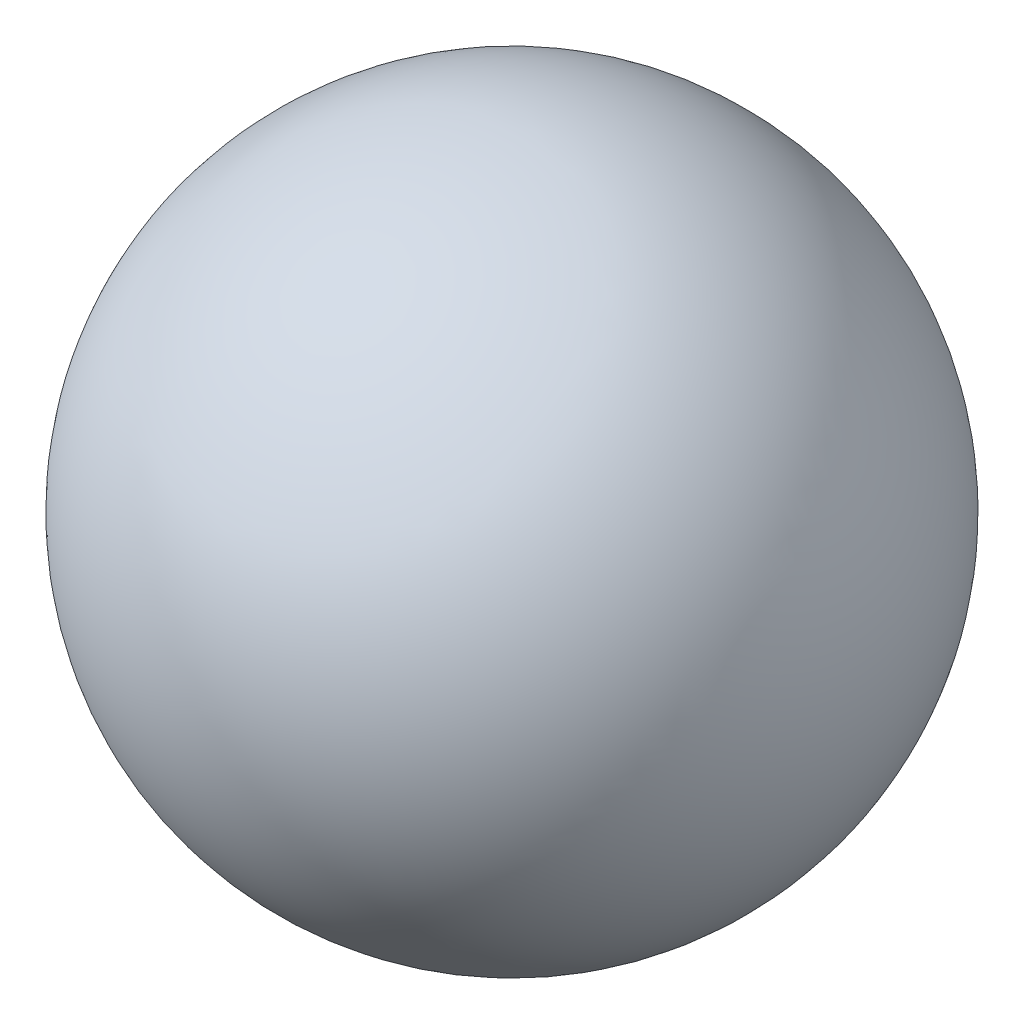
from build123d import *

# Parameters (mm, degrees)
SCALE1_SCALE = 0.07


with BuildPart() as part:
    # Sketch1 → Revolve1 (revolve)
    with BuildSketch(Plane.XY):
        with BuildLine():
            Line((-12, 0), (12, 0))
            ThreePointArc((12, 0), (0, -12), (-12, 0))
        make_face()
    revolve(axis=Axis((-12, 0, 0), (1, 0, 0)))


with BuildPart() as part_1:
    # Scale1: scaled about (0, 0, 0)
    add(part.part.scale(SCALE1_SCALE))


solid = part_1.part
